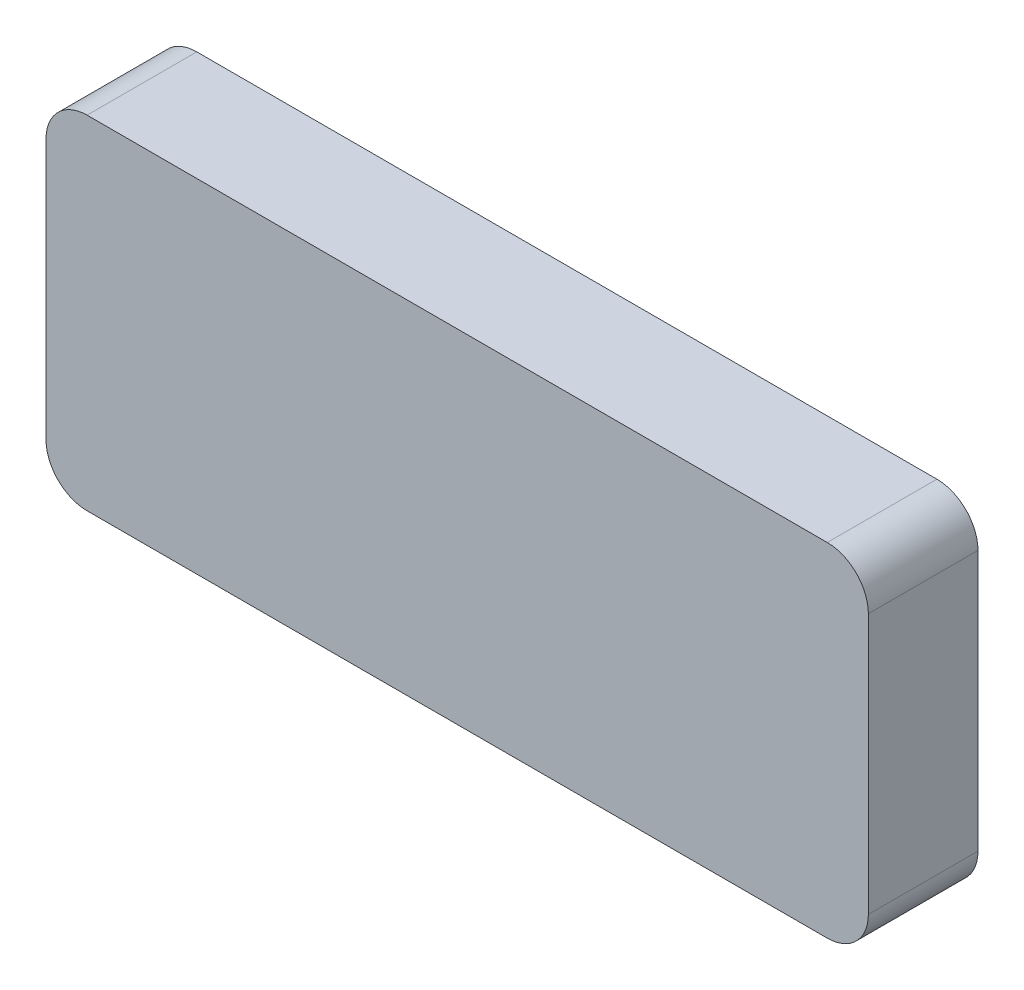
from build123d import *

# Parameters (mm, degrees)
IZIM1_W            = 60
IZIM1_H            = 25
TABAN_FLAN_1_DEPTH = 8
RADYUS1_R          = 3


# Sheet-metal steps are written as plain solids
with BuildPart() as part:
    # Çizim1 → Taban-Flanş1 (new body)
    with BuildSketch(Plane.XY):
        Rectangle(IZIM1_W, IZIM1_H)
    extrude(amount=-TABAN_FLAN_1_DEPTH)

    # Radyus1
    radyus1_edges = [part.edges().sort_by_distance(p)[0] for p in [
        (30, -12.5, -4),
        (-30, -12.5, -4),
        (-30, 12.5, -4),
        (30, 12.5, -4),
    ]]
    fillet(radyus1_edges, radius=RADYUS1_R)


solid = part.part
